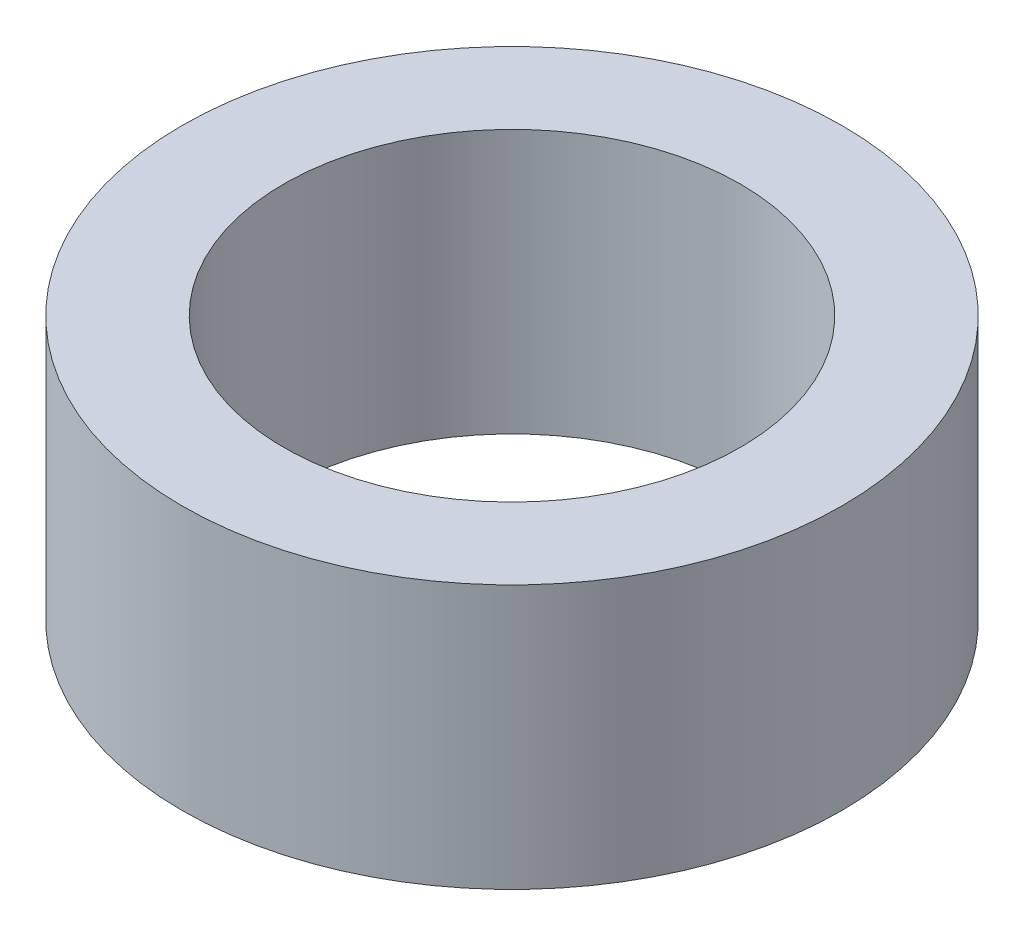
from build123d import *

# Parameters (mm, degrees)
SKETCH1_R           = 32.5
BOSS_EXTRUDE1_DEPTH = 26
SKETCH2_R           = 22.5
CUT_EXTRUDE1_DEPTH  = 53.80624963


with BuildPart() as part:
    # Sketch1 → Boss-Extrude1 (new body)
    with BuildSketch(Plane(origin=(0, 0, 0), x_dir=(1, 0, 0), z_dir=(0, 1, 0))):
        Circle(SKETCH1_R)
    extrude(amount=BOSS_EXTRUDE1_DEPTH)

    # Sketch2 → Cut-Extrude1 (cut, through all)
    with BuildSketch(Plane(origin=(0, 0, 0), x_dir=(1, 0, 0), z_dir=(0, 1, 0))):
        Circle(SKETCH2_R)
    extrude(amount=CUT_EXTRUDE1_DEPTH, mode=Mode.SUBTRACT)


solid = part.part
